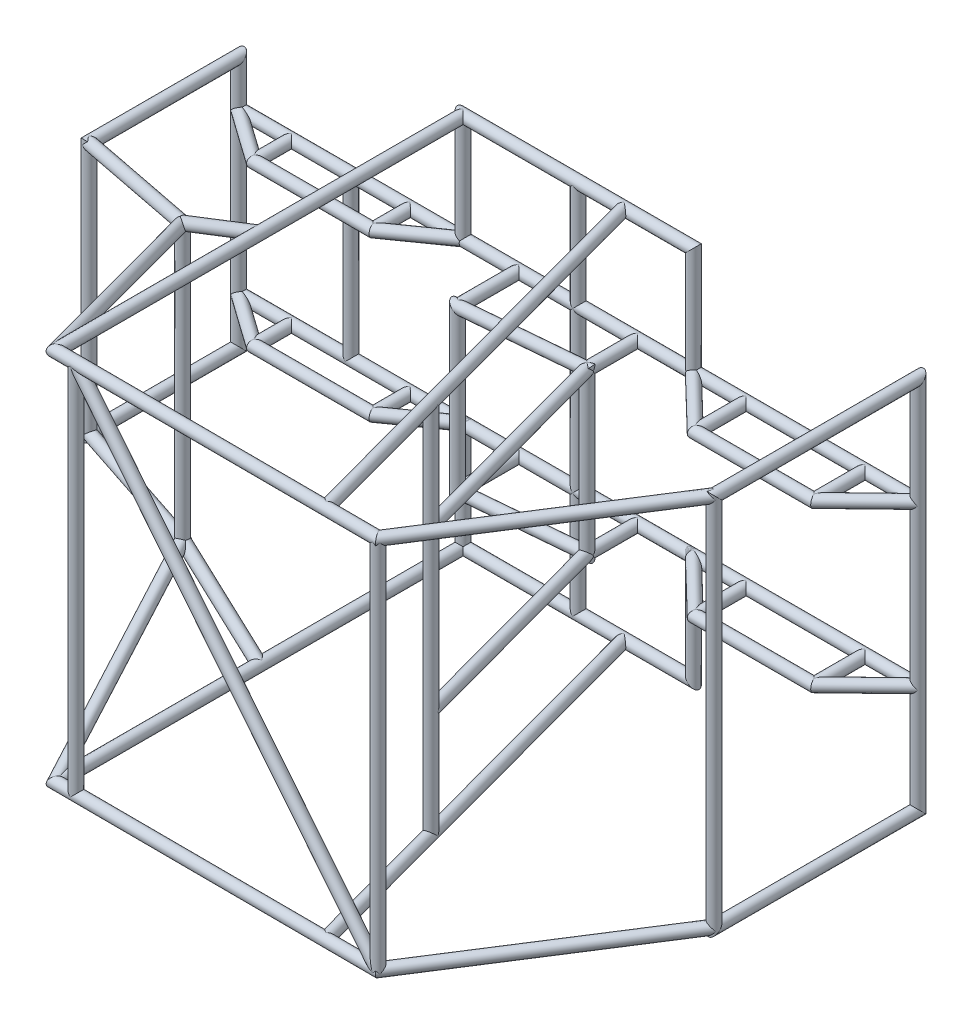
from build123d import *

# Parameters (mm, degrees)
SKETCH1171_R                     = 16.7005
SKETCH1171_R_2                   = 13.3223
PIPE_1_0_SCH_40_15_DEPTH         = 685.618073598
SKETCH1171_ON_SEGMENT_2_R        = 16.7005
SKETCH1171_ON_SEGMENT_2_R_2      = 13.3223
PIPE_1_0_SCH_40_15_2_DEPTH       = 364.236147197
SKETCH1171_ON_SEGMENT_3_R        = 16.7005
SKETCH1171_ON_SEGMENT_3_R_2      = 13.3223
PIPE_1_0_SCH_40_15_3_DEPTH       = 727.236147197
SKETCH1171_ON_SEGMENT_4_R        = 16.7005
SKETCH1171_ON_SEGMENT_4_R_2      = 13.3223
PIPE_1_0_SCH_40_15_4_DEPTH       = 364.236147197
SKETCH1171_ON_SEGMENT_5_R        = 16.7005
SKETCH1171_ON_SEGMENT_5_R_2      = 13.3223
PIPE_1_0_SCH_40_15_5_DEPTH       = 685.618073598
SKETCH118_R                      = 16.7005
SKETCH118_R_2                    = 13.3223
PIPE_1_0_SCH_40_16_DEPTH         = 685.618073598
SKETCH118_ON_SEGMENT_2_R         = 16.7005
SKETCH118_ON_SEGMENT_2_R_2       = 13.3223
PIPE_1_0_SCH_40_16_2_DEPTH       = 364.236147197
SKETCH118_ON_SEGMENT_3_R         = 16.7005
SKETCH118_ON_SEGMENT_3_R_2       = 13.3223
PIPE_1_0_SCH_40_16_3_DEPTH       = 727.236147197
SKETCH118_ON_SEGMENT_4_R         = 16.7005
SKETCH118_ON_SEGMENT_4_R_2       = 13.3223
PIPE_1_0_SCH_40_16_4_DEPTH       = 364.236147197
SKETCH118_ON_SEGMENT_5_R         = 16.7005
SKETCH118_ON_SEGMENT_5_R_2       = 13.3223
PIPE_1_0_SCH_40_16_5_DEPTH       = 685.618073598
PIPE_1_0_SCH_40_18_DEPTH         = 464.618073598
PIPE_1_0_SCH_40_18_DEPTH_BACK    = 24.618073598
SKETCH120_R                      = 16.7005
SKETCH120_R_2                    = 13.3223
SKETCH120_ON_SEGMENT_2_R         = 16.7005
SKETCH120_ON_SEGMENT_2_R_2       = 13.3223
PIPE_1_0_SCH_40_18_2_DEPTH       = 789.236147197
SKETCH120_ON_SEGMENT_3_R         = 16.7005
SKETCH120_ON_SEGMENT_3_R_2       = 13.3223
PIPE_1_0_SCH_40_18_3_DEPTH       = 489.236147197
SKETCH120_ON_SEGMENT_4_R         = 16.7005
SKETCH120_ON_SEGMENT_4_R_2       = 13.3223
PIPE_1_0_SCH_40_18_4_DEPTH       = 789.236147197
PIPE_1_0_SCH_40_19_DEPTH         = 624.618073598
PIPE_1_0_SCH_40_19_DEPTH_BACK    = 24.618073598
SKETCH121_R                      = 16.7005
SKETCH121_R_2                    = 13.3223
SKETCH121_ON_SEGMENT_2_R         = 16.7005
SKETCH121_ON_SEGMENT_2_R_2       = 13.3223
PIPE_1_0_SCH_40_19_2_DEPTH       = 1149.236147197
SKETCH121_ON_SEGMENT_3_R         = 16.7005
SKETCH121_ON_SEGMENT_3_R_2       = 13.3223
PIPE_1_0_SCH_40_19_3_DEPTH       = 649.236147197
SKETCH121_ON_SEGMENT_4_R         = 16.7005
SKETCH121_ON_SEGMENT_4_R_2       = 13.3223
PIPE_1_0_SCH_40_19_4_DEPTH       = 1149.236147197
SKETCH134_R                      = 16.7005
SKETCH134_R_2                    = 13.3223
PIPE_1_0_SCH_40_30_DEPTH         = 1100
SKETCH1186_R                     = 16.7005
SKETCH1186_R_2                   = 13.3223
PIPE_1_0_SCH_40_107_DEPTH        = 1200
SKETCH1186_ON_SEGMENT_2_R        = 16.7005
SKETCH1186_ON_SEGMENT_2_R_2      = 13.3223
PIPE_1_0_SCH_40_107_2_DEPTH      = 1200
SKETCH1187_R                     = 16.7005
SKETCH1187_R_2                   = 13.3223
PIPE_1_0_SCH_40_108_DEPTH        = 678
SKETCH1187_ON_SEGMENT_2_R        = 16.7005
SKETCH1187_ON_SEGMENT_2_R_2      = 13.3223
PIPE_1_0_SCH_40_108_2_DEPTH      = 678
PIPE_1_0_SCH_40_109_DEPTH        = 375.955016739
PIPE_1_0_SCH_40_109_DEPTH_BACK   = 24.618073598
SKETCH1188_R                     = 16.7005
SKETCH1188_R_2                   = 13.3223
SKETCH1188_ON_SEGMENT_2_R        = 16.7005
SKETCH1188_ON_SEGMENT_2_R_2      = 13.3223
PIPE_1_0_SCH_40_109_2_DEPTH      = 519.236147197
SKETCH1188_ON_SEGMENT_3_R        = 16.7005
SKETCH1188_ON_SEGMENT_3_R_2      = 13.3223
PIPE_1_0_SCH_40_109_3_DEPTH      = 400.573090337
SKETCH1188_ON_SEGMENT_4_R        = 16.7005
SKETCH1188_ON_SEGMENT_4_R_2      = 13.3223
PIPE_1_0_SCH_40_109_4_DEPTH      = 519.236147197
SKETCH1198_R                     = 16.7005
SKETCH1198_R_2                   = 13.3223
PIPE_1_0_SCH_40_168_DEPTH        = 180
SKETCH1198_ON_SEGMENT_2_R        = 16.7005
SKETCH1198_ON_SEGMENT_2_R_2      = 13.3223
PIPE_1_0_SCH_40_168_2_DEPTH      = 180
SKETCH1198_ON_SEGMENT_3_R        = 16.7005
SKETCH1198_ON_SEGMENT_3_R_2      = 13.3223
PIPE_1_0_SCH_40_168_3_DEPTH      = 149.378967766
SKETCH1198_ON_SEGMENT_4_R        = 16.7005
SKETCH1198_ON_SEGMENT_4_R_2      = 13.3223
PIPE_1_0_SCH_40_168_4_DEPTH      = 149.378967766
SKETCH1202_R                     = 16.7005
SKETCH1202_R_2                   = 13.3223
PIPE_1_0_SCH_40_207_DEPTH        = 1100
SKETCH1202_ON_SEGMENT_2_R        = 16.7005
SKETCH1202_ON_SEGMENT_2_R_2      = 13.3223
PIPE_1_0_SCH_40_207_2_DEPTH      = 1100
SKETCH1203_R                     = 16.7005
SKETCH1203_R_2                   = 13.3223
PIPE_1_0_SCH_40_208_DEPTH        = 1417.616753185
SKETCH1204_R                     = 16.7005
SKETCH1204_R_2                   = 13.3223
PIPE_1_0_SCH_40_209_DEPTH        = 1242.33611986
SKETCH1204_ON_SEGMENT_2_R        = 16.7005
SKETCH1204_ON_SEGMENT_2_R_2      = 13.3223
PIPE_1_0_SCH_40_209_2_DEPTH      = 1242.33611986
SKETCH1205_R                     = 16.7005
SKETCH1205_R_2                   = 13.3223
PIPE_1_0_SCH_40_210_DEPTH        = 1100
SKETCH1207_R                     = 16.7005
SKETCH1207_R_2                   = 13.3223
PIPE_1_0_SCH_40_234_DEPTH        = 650
SKETCH1208_R                     = 16.7005
SKETCH1208_R_2                   = 13.3223
PIPE_1_0_SCH_40_235_DEPTH        = 650
SKETCH1212_R                     = 16.7005
SKETCH1212_R_2                   = 13.3223
PIPE_1_0_SCH_40_351_DEPTH        = 404.242184059
SKETCH1212_ON_SEGMENT_2_R        = 16.7005
SKETCH1212_ON_SEGMENT_2_R_2      = 13.3223
PIPE_1_0_SCH_40_351_2_DEPTH      = 760.932128406
SKETCH1212_ON_SEGMENT_3_R        = 16.7005
SKETCH1212_ON_SEGMENT_3_R_2      = 13.3223
PIPE_1_0_SCH_40_351_3_DEPTH      = 980.503844292
SKETCH1212_ON_SEGMENT_4_R        = 16.7005
SKETCH1212_ON_SEGMENT_4_R_2      = 13.3223
PIPE_1_0_SCH_40_351_4_DEPTH      = 728.915360528
SKETCH1213_R                     = 16.7005
SKETCH1213_R_2                   = 13.3223
PIPE_1_0_SCH_40_352_DEPTH        = 404.244649491
SKETCH1213_ON_SEGMENT_2_R        = 16.7005
SKETCH1213_ON_SEGMENT_2_R_2      = 13.3223
PIPE_1_0_SCH_40_352_2_DEPTH      = 760.95722895
SKETCH1213_ON_SEGMENT_3_R        = 16.7005
SKETCH1213_ON_SEGMENT_3_R_2      = 13.3223
PIPE_1_0_SCH_40_352_3_DEPTH      = 980.530420984
SKETCH1213_ON_SEGMENT_4_R        = 16.7005
SKETCH1213_ON_SEGMENT_4_R_2      = 13.3223
PIPE_1_0_SCH_40_352_4_DEPTH      = 728.915360528
SKETCH1214_R                     = 16.7005
SKETCH1214_R_2                   = 13.3223
PIPE_1_0_SCH_40_353_DEPTH        = 808.307653414
SKETCH1215_R                     = 16.7005
SKETCH1215_R_2                   = 13.3223
PIPE_1_0_SCH_40_368_DEPTH        = 324.612827971
SKETCH1216_R                     = 16.7005
SKETCH1216_R_2                   = 13.3223
PIPE_1_0_SCH_40_369_DEPTH        = 324.610576097
SKETCH1225_R                     = 16.7005
SKETCH1225_R_2                   = 13.3223
PIPE_1_0_SCH_40_501_DEPTH        = 470
SKETCH1231_ON_SEGMENT_1_R        = 16.7005
SKETCH1231_ON_SEGMENT_1_R_2      = 13.3223
PIPE_1_0_SCH_40_533_DEPTH        = 198.982957257
SKETCH1231_ON_SEGMENT_2_R        = 16.7005
SKETCH1231_ON_SEGMENT_2_R_2      = 13.3223
PIPE_1_0_SCH_40_533_2_DEPTH      = 367.018411569
PIPE_1_0_SCH_40_533_3_DEPTH      = 190.473751472
PIPE_1_0_SCH_40_533_3_DEPTH_BACK = 8.509205784
SKETCH1231_R                     = 16.7005
SKETCH1231_R_2                   = 13.3223
SKETCH1232_ON_SEGMENT_1_R        = 16.7005
SKETCH1232_ON_SEGMENT_1_R_2      = 13.3223
PIPE_1_0_SCH_40_534_DEPTH        = 198.982957257
SKETCH1232_ON_SEGMENT_2_R        = 16.7005
SKETCH1232_ON_SEGMENT_2_R_2      = 13.3223
PIPE_1_0_SCH_40_534_2_DEPTH      = 367.018411569
PIPE_1_0_SCH_40_534_3_DEPTH      = 190.473751472
PIPE_1_0_SCH_40_534_3_DEPTH_BACK = 8.509205784
SKETCH1232_R                     = 16.7005
SKETCH1232_R_2                   = 13.3223
SKETCH1233_ON_SEGMENT_1_R        = 16.7005
SKETCH1233_ON_SEGMENT_1_R_2      = 13.3223
PIPE_1_0_SCH_40_535_DEPTH        = 226.590920724
SKETCH1233_ON_SEGMENT_2_R        = 16.7005
SKETCH1233_ON_SEGMENT_2_R_2      = 13.3223
PIPE_1_0_SCH_40_535_2_DEPTH      = 371.069587514
PIPE_1_0_SCH_40_535_3_DEPTH      = 216.056126967
PIPE_1_0_SCH_40_535_3_DEPTH_BACK = 10.534793757
SKETCH1233_R                     = 16.7005
SKETCH1233_R_2                   = 13.3223
SKETCH1234_ON_SEGMENT_1_R        = 16.7005
SKETCH1234_ON_SEGMENT_1_R_2      = 13.3223
PIPE_1_0_SCH_40_536_DEPTH        = 226.590920724
SKETCH1234_ON_SEGMENT_2_R        = 16.7005
SKETCH1234_ON_SEGMENT_2_R_2      = 13.3223
PIPE_1_0_SCH_40_536_2_DEPTH      = 371.069587514
PIPE_1_0_SCH_40_536_3_DEPTH      = 216.056126967
PIPE_1_0_SCH_40_536_3_DEPTH_BACK = 10.534793757
SKETCH1234_R                     = 16.7005
SKETCH1234_R_2                   = 13.3223
SKETCH1235_R                     = 16.7005
SKETCH1235_R_2                   = 13.3223
PIPE_1_0_SCH_40_537_DEPTH        = 110
SKETCH1235_ON_SEGMENT_2_R        = 16.7005
SKETCH1235_ON_SEGMENT_2_R_2      = 13.3223
PIPE_1_0_SCH_40_537_2_DEPTH      = 110
SKETCH1235_ON_SEGMENT_3_R        = 16.7005
SKETCH1235_ON_SEGMENT_3_R_2      = 13.3223
PIPE_1_0_SCH_40_537_3_DEPTH      = 110
SKETCH1235_ON_SEGMENT_4_R        = 16.7005
SKETCH1235_ON_SEGMENT_4_R_2      = 13.3223
PIPE_1_0_SCH_40_537_4_DEPTH      = 110
SKETCH1235_ON_SEGMENT_5_R        = 16.7005
SKETCH1235_ON_SEGMENT_5_R_2      = 13.3223
PIPE_1_0_SCH_40_537_5_DEPTH      = 150
SKETCH1235_ON_SEGMENT_6_R        = 16.7005
SKETCH1235_ON_SEGMENT_6_R_2      = 13.3223
PIPE_1_0_SCH_40_537_6_DEPTH      = 150
SKETCH1235_ON_SEGMENT_7_R        = 16.7005
SKETCH1235_ON_SEGMENT_7_R_2      = 13.3223
PIPE_1_0_SCH_40_537_7_DEPTH      = 150
SKETCH1235_ON_SEGMENT_8_R        = 16.7005
SKETCH1235_ON_SEGMENT_8_R_2      = 13.3223
PIPE_1_0_SCH_40_537_8_DEPTH      = 150


with BuildPart() as part:
    # Sketch1171 → Pipe 1.0 SCH 40(15) (new body)
    with BuildSketch(Plane(origin=(-979.966611018, -151.135225376, 0), x_dir=(0, 1, 0), z_dir=(1, 0, 0))):
        Circle(SKETCH1171_R)
        Circle(SKETCH1171_R_2, mode=Mode.SUBTRACT)
    extrude(amount=PIPE_1_0_SCH_40_15_DEPTH)

    # Pipe 1.0 SCH 40(15) mitre 1
    split(bisect_by=Plane(origin=(-318.966611018, -151.135225376, 0), x_dir=(-0.707106781, -0.707106781, 0), z_dir=(-0.707106781, 0.707106781, 0)), keep=Keep.TOP)


with BuildPart() as body_2:
    # Sketch1171 on segment 2 (carried to segment 2) → Pipe 1.0 SCH 40_15 2 (new body)
    with BuildSketch(Plane(origin=(-318.966611018, -126.517151777, 0), x_dir=(1, 0, 0), z_dir=(0, -1, 0))):
        Circle(SKETCH1171_ON_SEGMENT_2_R)
        Circle(SKETCH1171_ON_SEGMENT_2_R_2, mode=Mode.SUBTRACT)
    extrude(amount=PIPE_1_0_SCH_40_15_2_DEPTH)

    # Pipe 1.0 SCH 40_15 2 mitre 1
    split(bisect_by=Plane(origin=(-318.966611018, -151.135225376, 0), x_dir=(0.707106781, 0.707106781, 0), z_dir=(0.707106781, -0.707106781, 0)), keep=Keep.TOP)

    # Pipe 1.0 SCH 40_15 2 mitre 2
    split(bisect_by=Plane(origin=(-318.966611018, -466.135225376, 0), x_dir=(-0.707106781, -0.707106781, 0), z_dir=(-0.707106781, 0.707106781, 0)), keep=Keep.TOP)


with BuildPart() as body_3:
    # Sketch1171 on segment 3 (carried to segment 3) → Pipe 1.0 SCH 40_15 3 (new body)
    with BuildSketch(Plane(origin=(-343.584684617, -466.135225376, 0), x_dir=(0, 1, 0), z_dir=(1, 0, 0))):
        Circle(SKETCH1171_ON_SEGMENT_3_R)
        Circle(SKETCH1171_ON_SEGMENT_3_R_2, mode=Mode.SUBTRACT)
    extrude(amount=PIPE_1_0_SCH_40_15_3_DEPTH)

    # Pipe 1.0 SCH 40_15 3 mitre 1
    split(bisect_by=Plane(origin=(-318.966611018, -466.135225376, 0), x_dir=(0.707106781, 0.707106781, 0), z_dir=(0.707106781, -0.707106781, 0)), keep=Keep.TOP)

    # Pipe 1.0 SCH 40_15 3 mitre 2
    split(bisect_by=Plane(origin=(359.033388982, -466.135225376, 0), x_dir=(0.707106781, -0.707106781, 0), z_dir=(-0.707106781, -0.707106781, 0)), keep=Keep.TOP)


with BuildPart() as body_4:
    # Sketch1171 on segment 4 (carried to segment 4) → Pipe 1.0 SCH 40_15 4 (new body)
    with BuildSketch(Plane(origin=(359.033388982, -490.753298974, 0), x_dir=(-1, 0, 0), z_dir=(0, 1, 0))):
        Circle(SKETCH1171_ON_SEGMENT_4_R)
        Circle(SKETCH1171_ON_SEGMENT_4_R_2, mode=Mode.SUBTRACT)
    extrude(amount=PIPE_1_0_SCH_40_15_4_DEPTH)

    # Pipe 1.0 SCH 40_15 4 mitre 1
    split(bisect_by=Plane(origin=(359.033388982, -466.135225376, 0), x_dir=(-0.707106781, 0.707106781, 0), z_dir=(0.707106781, 0.707106781, 0)), keep=Keep.TOP)

    # Pipe 1.0 SCH 40_15 4 mitre 2
    split(bisect_by=Plane(origin=(359.033388982, -151.135225376, 0), x_dir=(0.707106781, -0.707106781, 0), z_dir=(-0.707106781, -0.707106781, 0)), keep=Keep.TOP)


with BuildPart() as body_5:
    # Sketch1171 on segment 5 (carried to segment 5) → Pipe 1.0 SCH 40_15 5 (new body)
    with BuildSketch(Plane(origin=(334.415315383, -151.135225376, 0), x_dir=(0, 1, 0), z_dir=(1, 0, 0))):
        Circle(SKETCH1171_ON_SEGMENT_5_R)
        Circle(SKETCH1171_ON_SEGMENT_5_R_2, mode=Mode.SUBTRACT)
    extrude(amount=PIPE_1_0_SCH_40_15_5_DEPTH)

    # Pipe 1.0 SCH 40_15 5 mitre 1
    split(bisect_by=Plane(origin=(359.033388982, -151.135225376, 0), x_dir=(-0.707106781, 0.707106781, 0), z_dir=(0.707106781, 0.707106781, 0)), keep=Keep.TOP)


with BuildPart() as body_6:
    # Sketch118 → Pipe 1.0 SCH 40(16) (new body)
    with BuildSketch(Plane(origin=(-979.966611018, 318.864774624, 0), x_dir=(0, 1, 0), z_dir=(1, 0, 0))):
        Circle(SKETCH118_R)
        Circle(SKETCH118_R_2, mode=Mode.SUBTRACT)
    extrude(amount=PIPE_1_0_SCH_40_16_DEPTH)

    # Pipe 1.0 SCH 40(16) mitre 1
    split(bisect_by=Plane(origin=(-318.966611018, 318.864774624, 0), x_dir=(0.707106781, -0.707106781, 0), z_dir=(-0.707106781, -0.707106781, 0)), keep=Keep.TOP)


with BuildPart() as body_7:
    # Sketch118 on segment 2 (carried to segment 2) → Pipe 1.0 SCH 40_16 2 (new body)
    with BuildSketch(Plane(origin=(-318.966611018, 294.246701026, 0), x_dir=(-1, 0, 0), z_dir=(0, 1, 0))):
        Circle(SKETCH118_ON_SEGMENT_2_R)
        Circle(SKETCH118_ON_SEGMENT_2_R_2, mode=Mode.SUBTRACT)
    extrude(amount=PIPE_1_0_SCH_40_16_2_DEPTH)

    # Pipe 1.0 SCH 40_16 2 mitre 1
    split(bisect_by=Plane(origin=(-318.966611018, 318.864774624, 0), x_dir=(-0.707106781, 0.707106781, 0), z_dir=(0.707106781, 0.707106781, 0)), keep=Keep.TOP)

    # Pipe 1.0 SCH 40_16 2 mitre 2
    split(bisect_by=Plane(origin=(-318.966611018, 633.864774624, 0), x_dir=(0.707106781, -0.707106781, 0), z_dir=(-0.707106781, -0.707106781, 0)), keep=Keep.TOP)


with BuildPart() as body_8:
    # Sketch118 on segment 3 (carried to segment 3) → Pipe 1.0 SCH 40_16 3 (new body)
    with BuildSketch(Plane(origin=(-343.584684617, 633.864774624, 0), x_dir=(0, 1, 0), z_dir=(1, 0, 0))):
        Circle(SKETCH118_ON_SEGMENT_3_R)
        Circle(SKETCH118_ON_SEGMENT_3_R_2, mode=Mode.SUBTRACT)
    extrude(amount=PIPE_1_0_SCH_40_16_3_DEPTH)

    # Pipe 1.0 SCH 40_16 3 mitre 1
    split(bisect_by=Plane(origin=(-318.966611018, 633.864774624, 0), x_dir=(-0.707106781, 0.707106781, 0), z_dir=(0.707106781, 0.707106781, 0)), keep=Keep.TOP)

    # Pipe 1.0 SCH 40_16 3 mitre 2
    split(bisect_by=Plane(origin=(359.033388982, 633.864774624, 0), x_dir=(-0.707106781, -0.707106781, 0), z_dir=(-0.707106781, 0.707106781, 0)), keep=Keep.TOP)


with BuildPart() as body_9:
    # Sketch118 on segment 4 (carried to segment 4) → Pipe 1.0 SCH 40_16 4 (new body)
    with BuildSketch(Plane(origin=(359.033388982, 658.482848223, 0), x_dir=(1, 0, 0), z_dir=(0, -1, 0))):
        Circle(SKETCH118_ON_SEGMENT_4_R)
        Circle(SKETCH118_ON_SEGMENT_4_R_2, mode=Mode.SUBTRACT)
    extrude(amount=PIPE_1_0_SCH_40_16_4_DEPTH)

    # Pipe 1.0 SCH 40_16 4 mitre 1
    split(bisect_by=Plane(origin=(359.033388982, 633.864774624, 0), x_dir=(0.707106781, 0.707106781, 0), z_dir=(0.707106781, -0.707106781, 0)), keep=Keep.TOP)

    # Pipe 1.0 SCH 40_16 4 mitre 2
    split(bisect_by=Plane(origin=(359.033388982, 318.864774624, 0), x_dir=(-0.707106781, -0.707106781, 0), z_dir=(-0.707106781, 0.707106781, 0)), keep=Keep.TOP)


with BuildPart() as body_10:
    # Sketch118 on segment 5 (carried to segment 5) → Pipe 1.0 SCH 40_16 5 (new body)
    with BuildSketch(Plane(origin=(334.415315383, 318.864774624, 0), x_dir=(0, 1, 0), z_dir=(1, 0, 0))):
        Circle(SKETCH118_ON_SEGMENT_5_R)
        Circle(SKETCH118_ON_SEGMENT_5_R_2, mode=Mode.SUBTRACT)
    extrude(amount=PIPE_1_0_SCH_40_16_5_DEPTH)

    # Pipe 1.0 SCH 40_16 5 mitre 1
    split(bisect_by=Plane(origin=(359.033388982, 318.864774624, 0), x_dir=(0.707106781, 0.707106781, 0), z_dir=(0.707106781, -0.707106781, 0)), keep=Keep.TOP)


with BuildPart() as body_11:
    # Sketch120 → Pipe 1.0 SCH 40(18) (new, two sides: drawn at the far end of the back side and taken through both)
    with BuildSketch(Plane(origin=(-979.966611018, -286.135225376, 0), x_dir=(1, 0, 0), z_dir=(0, 0, 1)).offset(-PIPE_1_0_SCH_40_18_DEPTH_BACK)):
        Circle(SKETCH120_R)
        Circle(SKETCH120_R_2, mode=Mode.SUBTRACT)
    extrude(amount=PIPE_1_0_SCH_40_18_DEPTH + PIPE_1_0_SCH_40_18_DEPTH_BACK)

    # Pipe 1.0 SCH 40(18) mitre 1
    split(bisect_by=Plane(origin=(-979.966611018, -286.135225376, 0), x_dir=(1, 0, 0), z_dir=(0, -0.707106781, 0.707106781)), keep=Keep.TOP)

    # Pipe 1.0 SCH 40(18) mitre 2
    split(bisect_by=Plane(origin=(-979.966611018, -286.135225376, 440), x_dir=(1, 0, 0), z_dir=(0, -0.707106781, -0.707106781)), keep=Keep.TOP)


with BuildPart() as body_12:
    # Sketch120 on segment 2 (carried to segment 2) → Pipe 1.0 SCH 40_18 2 (new body)
    with BuildSketch(Plane(origin=(-979.966611018, -310.753298974, 440), x_dir=(1, 0, 0), z_dir=(0, 1, 0))):
        Circle(SKETCH120_ON_SEGMENT_2_R)
        Circle(SKETCH120_ON_SEGMENT_2_R_2, mode=Mode.SUBTRACT)
    extrude(amount=PIPE_1_0_SCH_40_18_2_DEPTH)

    # Pipe 1.0 SCH 40_18 2 mitre 1
    split(bisect_by=Plane(origin=(-979.966611018, 453.864774624, 440), x_dir=(1, 0, 0), z_dir=(0, -0.707106781, 0.707106781)), keep=Keep.TOP)

    # Pipe 1.0 SCH 40_18 2 mitre 2
    split(bisect_by=Plane(origin=(-979.966611018, -286.135225376, 440), x_dir=(-1, 0, 0), z_dir=(0, 0.707106781, 0.707106781)), keep=Keep.TOP)


with BuildPart() as body_13:
    # Sketch120 on segment 3 (carried to segment 3) → Pipe 1.0 SCH 40_18 3 (new body)
    with BuildSketch(Plane(origin=(-979.966611018, 453.864774624, 464.618073598), x_dir=(1, 0, 0), z_dir=(0, 0, -1))):
        Circle(SKETCH120_ON_SEGMENT_3_R)
        Circle(SKETCH120_ON_SEGMENT_3_R_2, mode=Mode.SUBTRACT)
    extrude(amount=PIPE_1_0_SCH_40_18_3_DEPTH)

    # Pipe 1.0 SCH 40_18 3 mitre 1
    split(bisect_by=Plane(origin=(-979.966611018, 453.864774624, 0), x_dir=(-1, 0, 0), z_dir=(0, 0.707106781, 0.707106781)), keep=Keep.TOP)

    # Pipe 1.0 SCH 40_18 3 mitre 2
    split(bisect_by=Plane(origin=(-979.966611018, 453.864774624, 440), x_dir=(-1, 0, 0), z_dir=(0, 0.707106781, -0.707106781)), keep=Keep.TOP)


with BuildPart() as body_14:
    # Sketch120 on segment 4 (carried to segment 4) → Pipe 1.0 SCH 40_18 4 (new body)
    with BuildSketch(Plane(origin=(-979.966611018, 478.482848223, 0), x_dir=(1, 0, 0), z_dir=(0, -1, 0))):
        Circle(SKETCH120_ON_SEGMENT_4_R)
        Circle(SKETCH120_ON_SEGMENT_4_R_2, mode=Mode.SUBTRACT)
    extrude(amount=PIPE_1_0_SCH_40_18_4_DEPTH)

    # Pipe 1.0 SCH 40_18 4 mitre 1
    split(bisect_by=Plane(origin=(-979.966611018, -286.135225376, 0), x_dir=(-1, 0, 0), z_dir=(0, 0.707106781, -0.707106781)), keep=Keep.TOP)

    # Pipe 1.0 SCH 40_18 4 mitre 2
    split(bisect_by=Plane(origin=(-979.966611018, 453.864774624, 0), x_dir=(1, 0, 0), z_dir=(0, -0.707106781, -0.707106781)), keep=Keep.TOP)


with BuildPart() as body_15:
    # Sketch121 → Pipe 1.0 SCH 40(19) (new, two sides: drawn at the far end of the back side and taken through both)
    with BuildSketch(Plane(origin=(1020.033388982, -466.135225376, 0), x_dir=(1, 0, 0), z_dir=(0, 0, 1)).offset(-PIPE_1_0_SCH_40_19_DEPTH_BACK)):
        Circle(SKETCH121_R)
        Circle(SKETCH121_R_2, mode=Mode.SUBTRACT)
    extrude(amount=PIPE_1_0_SCH_40_19_DEPTH + PIPE_1_0_SCH_40_19_DEPTH_BACK)

    # Pipe 1.0 SCH 40(19) mitre 1
    split(bisect_by=Plane(origin=(1020.033388982, -466.135225376, 0), x_dir=(1, 0, 0), z_dir=(0, -0.707106781, 0.707106781)), keep=Keep.TOP)

    # Pipe 1.0 SCH 40(19) mitre 2
    split(bisect_by=Plane(origin=(1020.033388982, -466.135225376, 600), x_dir=(1, 0, 0), z_dir=(0, -0.707106781, -0.707106781)), keep=Keep.TOP)


with BuildPart() as body_16:
    # Sketch121 on segment 2 (carried to segment 2) → Pipe 1.0 SCH 40_19 2 (new body)
    with BuildSketch(Plane(origin=(1020.033388982, -490.753298974, 600), x_dir=(1, 0, 0), z_dir=(0, 1, 0))):
        Circle(SKETCH121_ON_SEGMENT_2_R)
        Circle(SKETCH121_ON_SEGMENT_2_R_2, mode=Mode.SUBTRACT)
    extrude(amount=PIPE_1_0_SCH_40_19_2_DEPTH)

    # Pipe 1.0 SCH 40_19 2 mitre 1
    split(bisect_by=Plane(origin=(1020.033388982, -466.135225376, 600), x_dir=(-1, 0, 0), z_dir=(0, 0.707106781, 0.707106781)), keep=Keep.TOP)

    # Pipe 1.0 SCH 40_19 2 mitre 2
    split(bisect_by=Plane(origin=(1020.033388982, 633.864774624, 600), x_dir=(1, 0, 0), z_dir=(0, -0.707106781, 0.707106781)), keep=Keep.TOP)


with BuildPart() as body_17:
    # Sketch121 on segment 3 (carried to segment 3) → Pipe 1.0 SCH 40_19 3 (new body)
    with BuildSketch(Plane(origin=(1020.033388982, 633.864774624, 624.618073598), x_dir=(1, 0, 0), z_dir=(0, 0, -1))):
        Circle(SKETCH121_ON_SEGMENT_3_R)
        Circle(SKETCH121_ON_SEGMENT_3_R_2, mode=Mode.SUBTRACT)
    extrude(amount=PIPE_1_0_SCH_40_19_3_DEPTH)

    # Pipe 1.0 SCH 40_19 3 mitre 1
    split(bisect_by=Plane(origin=(1020.033388982, 633.864774624, 0), x_dir=(-1, 0, 0), z_dir=(0, 0.707106781, 0.707106781)), keep=Keep.TOP)

    # Pipe 1.0 SCH 40_19 3 mitre 2
    split(bisect_by=Plane(origin=(1020.033388982, 633.864774624, 600), x_dir=(-1, 0, 0), z_dir=(0, 0.707106781, -0.707106781)), keep=Keep.TOP)


with BuildPart() as body_18:
    # Sketch121 on segment 4 (carried to segment 4) → Pipe 1.0 SCH 40_19 4 (new body)
    with BuildSketch(Plane(origin=(1020.033388982, 658.482848223, 0), x_dir=(1, 0, 0), z_dir=(0, -1, 0))):
        Circle(SKETCH121_ON_SEGMENT_4_R)
        Circle(SKETCH121_ON_SEGMENT_4_R_2, mode=Mode.SUBTRACT)
    extrude(amount=PIPE_1_0_SCH_40_19_4_DEPTH)

    # Pipe 1.0 SCH 40_19 4 mitre 1
    split(bisect_by=Plane(origin=(1020.033388982, 633.864774624, 0), x_dir=(1, 0, 0), z_dir=(0, -0.707106781, -0.707106781)), keep=Keep.TOP)

    # Pipe 1.0 SCH 40_19 4 mitre 2
    split(bisect_by=Plane(origin=(1020.033388982, -466.135225376, 0), x_dir=(-1, 0, 0), z_dir=(0, 0.707106781, -0.707106781)), keep=Keep.TOP)


with BuildPart() as body_19:
    # Sketch134 → Pipe 1.0 SCH 40(30) (new body)
    with BuildSketch(Plane(origin=(20.033388982, -466.135225376, 0), x_dir=(1, 0, 0), z_dir=(0, 1, 0))):
        Circle(SKETCH134_R)
        Circle(SKETCH134_R_2, mode=Mode.SUBTRACT)
    extrude(amount=PIPE_1_0_SCH_40_30_DEPTH)


with BuildPart() as body_20:
    # Sketch1186 → Pipe 1.0 SCH 40(107) (new body)
    with BuildSketch(Plane(origin=(-318.966611018, 633.864774624, 0), x_dir=(1, 0, 0), z_dir=(0, 0, 1))):
        Circle(SKETCH1186_R)
        Circle(SKETCH1186_R_2, mode=Mode.SUBTRACT)
    extrude(amount=PIPE_1_0_SCH_40_107_DEPTH)


with BuildPart() as body_21:
    # Sketch1186 on segment 2 (carried to segment 2) → Pipe 1.0 SCH 40_107 2 (new body)
    with BuildSketch(Plane(origin=(-318.966611018, -466.135225376, 0), x_dir=(1, 0, 0), z_dir=(0, 0, 1))):
        Circle(SKETCH1186_ON_SEGMENT_2_R)
        Circle(SKETCH1186_ON_SEGMENT_2_R_2, mode=Mode.SUBTRACT)
    extrude(amount=PIPE_1_0_SCH_40_107_2_DEPTH)


with BuildPart() as body_22:
    # Sketch1187 → Pipe 1.0 SCH 40(108) (new body)
    with BuildSketch(Plane(origin=(-318.966611018, -151.135225376, 0), x_dir=(0, 0, -1), z_dir=(1, 0, 0))):
        Circle(SKETCH1187_R)
        Circle(SKETCH1187_R_2, mode=Mode.SUBTRACT)
    extrude(amount=PIPE_1_0_SCH_40_108_DEPTH)


with BuildPart() as body_23:
    # Sketch1187 on segment 2 (carried to segment 2) → Pipe 1.0 SCH 40_108 2 (new body)
    with BuildSketch(Plane(origin=(-318.966611018, 318.864774624, 0), x_dir=(0, 0, -1), z_dir=(1, 0, 0))):
        Circle(SKETCH1187_ON_SEGMENT_2_R)
        Circle(SKETCH1187_ON_SEGMENT_2_R_2, mode=Mode.SUBTRACT)
    extrude(amount=PIPE_1_0_SCH_40_108_2_DEPTH)


with BuildPart() as body_24:
    # Sketch1188 → Pipe 1.0 SCH 40(109) (new, two sides: drawn at the far end of the back side and taken through both)
    with BuildSketch(Plane(origin=(-154.966611018, -151.135225376, 180), x_dir=(-0.08715574274766213, 0, -0.9961946980917453), z_dir=(0.9961946980917453, 0, -0.08715574274766213)).offset(-PIPE_1_0_SCH_40_109_DEPTH_BACK)):
        Circle(SKETCH1188_R)
        Circle(SKETCH1188_R_2, mode=Mode.SUBTRACT)
    extrude(amount=PIPE_1_0_SCH_40_109_DEPTH + PIPE_1_0_SCH_40_109_DEPTH_BACK)

    # Pipe 1.0 SCH 40(109) mitre 1
    split(bisect_by=Plane(origin=(-154.966611018, -151.135225376, 180), x_dir=(0.708453436, 0.705757557, 0), z_dir=(0.704416026, -0.707106781, -0.061628417)), keep=Keep.TOP)

    # Pipe 1.0 SCH 40(109) mitre 2
    split(bisect_by=Plane(origin=(195.033388982, -151.135225376, 149.378967766), x_dir=(0.708453436, -0.705757557, 0), z_dir=(-0.704416026, -0.707106781, 0.061628417)), keep=Keep.TOP)


with BuildPart() as body_25:
    # Sketch1188 on segment 2 (carried to segment 2) → Pipe 1.0 SCH 40_109 2 (new body)
    with BuildSketch(Plane(origin=(195.033388982, -175.753298974, 149.378967766), x_dir=(-0.087155743, 0, -0.996194698), z_dir=(0, 1, 0))):
        Circle(SKETCH1188_ON_SEGMENT_2_R)
        Circle(SKETCH1188_ON_SEGMENT_2_R_2, mode=Mode.SUBTRACT)
    extrude(amount=PIPE_1_0_SCH_40_109_2_DEPTH)

    # Pipe 1.0 SCH 40_109 2 mitre 1
    split(bisect_by=Plane(origin=(195.033388982, -151.135225376, 149.378967766), x_dir=(-0.708453436, 0.705757557, 0), z_dir=(0.704416026, 0.707106781, -0.061628417)), keep=Keep.TOP)

    # Pipe 1.0 SCH 40_109 2 mitre 2
    split(bisect_by=Plane(origin=(195.033388981, 318.864774624, 149.378967766), x_dir=(0.708453436, 0.705757557, 0), z_dir=(0.704416026, -0.707106781, -0.061628417)), keep=Keep.TOP)


with BuildPart() as body_26:
    # Sketch1188 on segment 3 (carried to segment 3) → Pipe 1.0 SCH 40_109 3 (new body)
    with BuildSketch(Plane(origin=(219.557783377, 318.864774624, 147.233361276), x_dir=(-0.087155743, 0, -0.996194698), z_dir=(-0.996194698, 0, 0.087155743))):
        Circle(SKETCH1188_ON_SEGMENT_3_R)
        Circle(SKETCH1188_ON_SEGMENT_3_R_2, mode=Mode.SUBTRACT)
    extrude(amount=PIPE_1_0_SCH_40_109_3_DEPTH)

    # Pipe 1.0 SCH 40_109 3 mitre 1
    split(bisect_by=Plane(origin=(-154.966611018, 318.864774624, 180), x_dir=(-0.708453436, 0.705757557, 0), z_dir=(0.704416026, 0.707106781, -0.061628417)), keep=Keep.TOP)

    # Pipe 1.0 SCH 40_109 3 mitre 2
    split(bisect_by=Plane(origin=(195.033388981, 318.864774624, 149.378967766), x_dir=(-0.708453436, -0.705757557, 0), z_dir=(-0.704416026, 0.707106781, 0.061628417)), keep=Keep.TOP)


with BuildPart() as body_27:
    # Sketch1188 on segment 4 (carried to segment 4) → Pipe 1.0 SCH 40_109 4 (new body)
    with BuildSketch(Plane(origin=(-154.966611018, 343.482848223, 180), x_dir=(-0.087155743, 0, -0.996194698), z_dir=(0, -1, 0))):
        Circle(SKETCH1188_ON_SEGMENT_4_R)
        Circle(SKETCH1188_ON_SEGMENT_4_R_2, mode=Mode.SUBTRACT)
    extrude(amount=PIPE_1_0_SCH_40_109_4_DEPTH)

    # Pipe 1.0 SCH 40_109 4 mitre 1
    split(bisect_by=Plane(origin=(-154.966611018, -151.135225376, 180), x_dir=(-0.708453436, -0.705757557, 0), z_dir=(-0.704416026, 0.707106781, 0.061628417)), keep=Keep.TOP)

    # Pipe 1.0 SCH 40_109 4 mitre 2
    split(bisect_by=Plane(origin=(-154.966611018, 318.864774624, 180), x_dir=(0.708453436, -0.705757557, 0), z_dir=(-0.704416026, -0.707106781, 0.061628417)), keep=Keep.TOP)


with BuildPart() as body_28:
    # Sketch1198 → Pipe 1.0 SCH 40(168) (new body)
    with BuildSketch(Plane(origin=(-154.966611018, -151.135225376, 0), x_dir=(1, 0, 0), z_dir=(0, 0, 1))):
        Circle(SKETCH1198_R)
        Circle(SKETCH1198_R_2, mode=Mode.SUBTRACT)
    extrude(amount=PIPE_1_0_SCH_40_168_DEPTH)


with BuildPart() as body_29:
    # Sketch1198 on segment 2 (carried to segment 2) → Pipe 1.0 SCH 40_168 2 (new body)
    with BuildSketch(Plane(origin=(-154.966611018, 318.864774624, 0), x_dir=(1, 0, 0), z_dir=(0, 0, 1))):
        Circle(SKETCH1198_ON_SEGMENT_2_R)
        Circle(SKETCH1198_ON_SEGMENT_2_R_2, mode=Mode.SUBTRACT)
    extrude(amount=PIPE_1_0_SCH_40_168_2_DEPTH)


with BuildPart() as body_30:
    # Sketch1198 on segment 3 (carried to segment 3) → Pipe 1.0 SCH 40_168 3 (new body)
    with BuildSketch(Plane(origin=(195.033388981, 318.864774624, 0), x_dir=(1, 0, 0), z_dir=(0, 0, 1))):
        Circle(SKETCH1198_ON_SEGMENT_3_R)
        Circle(SKETCH1198_ON_SEGMENT_3_R_2, mode=Mode.SUBTRACT)
    extrude(amount=PIPE_1_0_SCH_40_168_3_DEPTH)


with BuildPart() as body_31:
    # Sketch1198 on segment 4 (carried to segment 4) → Pipe 1.0 SCH 40_168 4 (new body)
    with BuildSketch(Plane(origin=(195.033388982, -151.135225376, 0), x_dir=(1, 0, 0), z_dir=(0, 0, 1))):
        Circle(SKETCH1198_ON_SEGMENT_4_R)
        Circle(SKETCH1198_ON_SEGMENT_4_R_2, mode=Mode.SUBTRACT)
    extrude(amount=PIPE_1_0_SCH_40_168_4_DEPTH)


with BuildPart() as body_32:
    # Sketch1202 → Pipe 1.0 SCH 40(207) (new body)
    with BuildSketch(Plane(origin=(-258.966611018, 633.864774624, 1200), x_dir=(1, 0, 0), z_dir=(0, -1, 0))):
        Circle(SKETCH1202_R)
        Circle(SKETCH1202_R_2, mode=Mode.SUBTRACT)
    extrude(amount=PIPE_1_0_SCH_40_207_DEPTH)


with BuildPart() as body_33:
    # Sketch1202 on segment 2 (carried to segment 2) → Pipe 1.0 SCH 40_207 2 (new body)
    with BuildSketch(Plane(origin=(631.02721246, 630.439084748, 1200.001330856), x_dir=(1, 0, 0), z_dir=(0, -1, 0))):
        Circle(SKETCH1202_ON_SEGMENT_2_R)
        Circle(SKETCH1202_ON_SEGMENT_2_R_2, mode=Mode.SUBTRACT)
    extrude(amount=PIPE_1_0_SCH_40_207_2_DEPTH)


with BuildPart() as body_34:
    # Sketch1203 → Pipe 1.0 SCH 40(208) (new body)
    with BuildSketch(Plane(origin=(-258.966611018, 633.864774624, 1200), x_dir=(0.6058551070813424, 0.48866586363505715, -0.6278098939497999), z_dir=(0.6278098939497999, -0.7783667111701654, 9.38798416422193e-07))):
        Circle(SKETCH1203_R)
        Circle(SKETCH1203_R_2, mode=Mode.SUBTRACT)
    extrude(amount=PIPE_1_0_SCH_40_208_DEPTH)


with BuildPart() as body_35:
    # Sketch1204 → Pipe 1.0 SCH 40(209) (new body)
    with BuildSketch(Plane(origin=(476.536808362, 630.996179121, 1200.001114429), x_dir=(-0.9657666076639697, 0.017537428929163046, 0.2588190451025248), z_dir=(-0.2588190451025248, 0.002309033326389314, -0.965923066427816))):
        Circle(SKETCH1204_R)
        Circle(SKETCH1204_R_2, mode=Mode.SUBTRACT)
    extrude(amount=PIPE_1_0_SCH_40_209_DEPTH)


with BuildPart() as body_36:
    # Sketch1204 on segment 2 (carried to segment 2) → Pipe 1.0 SCH 40_209 2 (new body)
    with BuildSketch(Plane(origin=(476.536808362, -469.003820879, 1200.001114429), x_dir=(-0.965766608, 0.017537429, 0.258819045), z_dir=(-0.258819045, 0.002309033, -0.965923066))):
        Circle(SKETCH1204_ON_SEGMENT_2_R)
        Circle(SKETCH1204_ON_SEGMENT_2_R_2, mode=Mode.SUBTRACT)
    extrude(amount=PIPE_1_0_SCH_40_209_2_DEPTH)


with BuildPart() as body_37:
    # Sketch1205 → Pipe 1.0 SCH 40(210) (new body)
    with BuildSketch(Plane(origin=(363.255508261, -467.993190857, 777.230754854), x_dir=(1, 0, 0), z_dir=(0, 1, 0))):
        Circle(SKETCH1205_R)
        Circle(SKETCH1205_R_2, mode=Mode.SUBTRACT)
    extrude(amount=PIPE_1_0_SCH_40_210_DEPTH)


with BuildPart() as body_38:
    # Sketch1207 → Pipe 1.0 SCH 40(234) (new body)
    with BuildSketch(Plane(origin=(195.033388981, 318.864774624, 149.378967766), x_dir=(0.9659299823455487, 0.00037629365881759703, -0.25880326042963675), z_dir=(0.25880326042963675, -0.0028584084331481907, 0.9659258262890682))):
        Circle(SKETCH1207_R)
        Circle(SKETCH1207_R_2, mode=Mode.SUBTRACT)
    extrude(amount=PIPE_1_0_SCH_40_234_DEPTH)


with BuildPart() as body_39:
    # Sketch1208 → Pipe 1.0 SCH 40(235) (new body)
    with BuildSketch(Plane(origin=(195.033388982, -151.135225376, 149.378967766), x_dir=(0.9659299823456771, 0.00037629365881684145, -0.2588032604291579), z_dir=(0.2588032604291579, -0.002858408433147929, 0.9659258262891964))):
        Circle(SKETCH1208_R)
        Circle(SKETCH1208_R_2, mode=Mode.SUBTRACT)
    extrude(amount=PIPE_1_0_SCH_40_235_DEPTH)


with BuildPart() as body_40:
    # Sketch1212 → Pipe 1.0 SCH 40(351) (new body)
    with BuildSketch(Plane(origin=(-979.966611018, -286.135225376, 440), x_dir=(0.2648533703087091, 0.06660415781159988, -0.9619857475026985), z_dir=(0.9619857475026985, -0.08715574274765481, 0.25881904510251813))):
        Circle(SKETCH1212_R)
        Circle(SKETCH1212_R_2, mode=Mode.SUBTRACT)
    extrude(amount=PIPE_1_0_SCH_40_351_DEPTH)

    # Pipe 1.0 SCH 40(351) mitre 1
    split(bisect_by=Plane(origin=(-602.993256144, -320.288946286, 541.423419204), x_dir=(-0.207540893, -0.978226343, 0), z_dir=(-0.749204676, 0.158951565, -0.6429827)), keep=Keep.TOP)


with BuildPart() as body_41:
    # Sketch1212 on segment 2 (carried to segment 2) → Pipe 1.0 SCH 40_351 2 (new body)
    with BuildSketch(Plane(origin=(-607.794554176, -317.823503467, 530.290581862), x_dir=(0.91021475, -0.070315971, -0.408123478), z_dir=(0.388071985, -0.199273047, 0.899827976))):
        Circle(SKETCH1212_ON_SEGMENT_2_R)
        Circle(SKETCH1212_ON_SEGMENT_2_R_2, mode=Mode.SUBTRACT)
    extrude(amount=PIPE_1_0_SCH_40_351_2_DEPTH)

    # Pipe 1.0 SCH 40_351 2 mitre 1
    split(bisect_by=Plane(origin=(-602.993256144, -320.288946286, 541.423419204), x_dir=(0.207540893, 0.978226343, 0), z_dir=(0.749204676, -0.158951565, 0.6429827)), keep=Keep.TOP)

    # Pipe 1.0 SCH 40_351 2 mitre 2
    split(bisect_by=Plane(origin=(-318.966611018, -466.135225376, 1200), x_dir=(-0.144622958, -0.989486837, 0), z_dir=(-0.832869151, 0.121731786, -0.539916984)), keep=Keep.TOP)


with BuildPart() as body_42:
    # Sketch1212 on segment 3 (carried to segment 3) → Pipe 1.0 SCH 40_351 3 (new body)
    with BuildSketch(Plane(origin=(-335.634798568, -466.075119678, 1199.999976649), x_dir=(0.000285706, 0.078843135, -0.996886994), z_dir=(0.999993498, -0.003605989, 1.401e-06))):
        Circle(SKETCH1212_ON_SEGMENT_3_R)
        Circle(SKETCH1212_ON_SEGMENT_3_R_2, mode=Mode.SUBTRACT)
    extrude(amount=PIPE_1_0_SCH_40_351_3_DEPTH)

    # Pipe 1.0 SCH 40_351 3 mitre 1
    split(bisect_by=Plane(origin=(-318.966611018, -466.135225376, 1200), x_dir=(0.144622958, 0.989486837, 0), z_dir=(0.832869151, -0.121731786, 0.539916984)), keep=Keep.TOP)

    # Pipe 1.0 SCH 40_351 3 mitre 2
    split(bisect_by=Plane(origin=(631.02721246, -469.560915252, 1200.001330856), x_dir=(0.000767262, -0.999999706, 0), z_dir=(-0.878638959, -0.000674146, 0.477486256)), keep=Keep.TOP)


with BuildPart() as body_43:
    # Sketch1212 on segment 4 (carried to segment 4) → Pipe 1.0 SCH 40_351 4 (new body)
    with BuildSketch(Plane(origin=(623.500620769, -469.627196382, 1211.610311135), x_dir=(-0.832654105, 0.126628686, -0.539121802), z_dir=(0.544003858, 0.00479064, -0.839069039))):
        Circle(SKETCH1212_ON_SEGMENT_4_R)
        Circle(SKETCH1212_ON_SEGMENT_4_R_2, mode=Mode.SUBTRACT)
    extrude(amount=PIPE_1_0_SCH_40_351_4_DEPTH)

    # Pipe 1.0 SCH 40_351 4 mitre 1
    split(bisect_by=Plane(origin=(631.02721246, -469.560915252, 1200.001330856), x_dir=(-0.000767262, 0.999999706, 0), z_dir=(0.878638959, 0.000674146, -0.477486256)), keep=Keep.TOP)


with BuildPart() as body_44:
    # Sketch1213 → Pipe 1.0 SCH 40(352) (new body)
    with BuildSketch(Plane(origin=(-979.966611018, 453.864774624, 440), x_dir=(0.26485337030871003, -0.06660415781160522, -0.9619857475026978), z_dir=(0.9619857475026977, 0.08715574274766187, 0.258819045102518))):
        Circle(SKETCH1213_R)
        Circle(SKETCH1213_R_2, mode=Mode.SUBTRACT)
    extrude(amount=PIPE_1_0_SCH_40_352_DEPTH)

    # Pipe 1.0 SCH 40(352) mitre 1
    split(bisect_by=Plane(origin=(-602.990920722, 488.018707124, 541.424047542), x_dir=(0.20754133, -0.97822625, 0), z_dir=(-0.749203819, -0.158951732, -0.642983658)), keep=Keep.TOP)


with BuildPart() as body_45:
    # Sketch1213 on segment 2 (carried to segment 2) → Pipe 1.0 SCH 40_352 2 (new body)
    with BuildSketch(Plane(origin=(-607.792203844, 485.553255265, 530.29116385), x_dir=(0.910215749, 0.070316484, -0.408121161), z_dir=(0.388069597, 0.19927317, 0.899828979))):
        Circle(SKETCH1213_ON_SEGMENT_2_R)
        Circle(SKETCH1213_ON_SEGMENT_2_R_2, mode=Mode.SUBTRACT)
    extrude(amount=PIPE_1_0_SCH_40_352_2_DEPTH)

    # Pipe 1.0 SCH 40_352 2 mitre 1
    split(bisect_by=Plane(origin=(-602.990920722, 488.018707124, 541.424047542), x_dir=(-0.20754133, 0.97822625, 0), z_dir=(0.749203819, 0.158951732, 0.642983658)), keep=Keep.TOP)

    # Pipe 1.0 SCH 40_352 2 mitre 2
    split(bisect_by=Plane(origin=(-318.966611018, 633.864774624, 1200), x_dir=(0.139584174, -0.990210209, 0), z_dir=(-0.833299706, -0.117465413, -0.540197627)), keep=Keep.TOP)


with BuildPart() as body_46:
    # Sketch1213 on segment 3 (carried to segment 3) → Pipe 1.0 SCH 40_352 3 (new body)
    with BuildSketch(Plane(origin=(-335.661375086, 633.924976157, 1199.999976612), x_dir=(-0.000279493, -0.077894688, -0.996961554), z_dir=(0.999993498, -0.003605989, 1.401e-06))):
        Circle(SKETCH1213_ON_SEGMENT_3_R)
        Circle(SKETCH1213_ON_SEGMENT_3_R_2, mode=Mode.SUBTRACT)
    extrude(amount=PIPE_1_0_SCH_40_352_3_DEPTH)

    # Pipe 1.0 SCH 40_352 3 mitre 1
    split(bisect_by=Plane(origin=(-318.966611018, 633.864774624, 1200), x_dir=(-0.139584174, 0.990210209, 0), z_dir=(0.833299706, 0.117465413, 0.540197627)), keep=Keep.TOP)

    # Pipe 1.0 SCH 40_352 3 mitre 2
    split(bisect_by=Plane(origin=(631.02721246, 630.439084748, 1200.001330856), x_dir=(0.000767262, -0.999999706, 0), z_dir=(-0.878638959, -0.000674146, 0.477486256)), keep=Keep.TOP)


with BuildPart() as body_47:
    # Sketch1213 on segment 4 (carried to segment 4) → Pipe 1.0 SCH 40_352 4 (new body)
    with BuildSketch(Plane(origin=(623.500620769, 630.372803618, 1211.610311135), x_dir=(-0.83121711, -0.133523422, -0.539675469), z_dir=(0.544003858, 0.00479064, -0.839069039))):
        Circle(SKETCH1213_ON_SEGMENT_4_R)
        Circle(SKETCH1213_ON_SEGMENT_4_R_2, mode=Mode.SUBTRACT)
    extrude(amount=PIPE_1_0_SCH_40_352_4_DEPTH)

    # Pipe 1.0 SCH 40_352 4 mitre 1
    split(bisect_by=Plane(origin=(631.02721246, 630.439084748, 1200.001330856), x_dir=(-0.000767262, 0.999999706, 0), z_dir=(0.878638959, 0.000674146, -0.477486256)), keep=Keep.TOP)


with BuildPart() as body_48:
    # Sketch1214 → Pipe 1.0 SCH 40(353) (new body)
    with BuildSketch(Plane(origin=(-602.990920722, 488.018707124, 541.424047542), x_dir=(0.9999999999916522, -2.889277035180574e-06, 2.889274789214842e-06), z_dir=(-2.8892747892148405e-06, -0.9999999999955239, -7.77349710095772e-07))):
        Circle(SKETCH1214_R)
        Circle(SKETCH1214_R_2, mode=Mode.SUBTRACT)
    extrude(amount=PIPE_1_0_SCH_40_353_DEPTH)


with BuildPart() as body_49:
    # Sketch1215 → Pipe 1.0 SCH 40(368) (new body)
    with BuildSketch(Plane(origin=(-602.993256144, -320.288946286, 541.423419204), x_dir=(0.3514566761188176, 0.3330237928008184, -0.8749704899252718), z_dir=(0.8749704899252718, -0.4492930239415867, 0.18045060376001715))):
        Circle(SKETCH1215_R)
        Circle(SKETCH1215_R_2, mode=Mode.SUBTRACT)
    extrude(amount=PIPE_1_0_SCH_40_368_DEPTH)


with BuildPart() as body_50:
    # Sketch1216 → Pipe 1.0 SCH 40(369) (new body)
    with BuildSketch(Plane(origin=(-602.990920722, 488.018707124, 541.424047542), x_dir=(0.35145796774757293, -0.3330253847344339, -0.874969365194707), z_dir=(0.8749693651947068, 0.4492954889335472, 0.18044991990781373))):
        Circle(SKETCH1216_R)
        Circle(SKETCH1216_R_2, mode=Mode.SUBTRACT)
    extrude(amount=PIPE_1_0_SCH_40_369_DEPTH)


with BuildPart() as body_51:
    # Sketch1225 → Pipe 1.0 SCH 40(501) (new body)
    with BuildSketch(Plane(origin=(-649.466611018, 318.864774624, 0), x_dir=(1, 0, 0), z_dir=(0, -1, 0))):
        Circle(SKETCH1225_R)
        Circle(SKETCH1225_R_2, mode=Mode.SUBTRACT)
    extrude(amount=PIPE_1_0_SCH_40_501_DEPTH)


with BuildPart() as body_52:
    # Sketch1231 on segment 1 (carried to segment 1) → Pipe 1.0 SCH 40(533) (new body)
    with BuildSketch(Plane(origin=(-318.966611018, 318.864774624, 0), x_dir=(0.577507395, 0, 0.816385454), z_dir=(-0.816385454, 0, 0.577507395))):
        Circle(SKETCH1231_ON_SEGMENT_1_R)
        Circle(SKETCH1231_ON_SEGMENT_1_R_2, mode=Mode.SUBTRACT)
    extrude(amount=PIPE_1_0_SCH_40_533_DEPTH)

    # Pipe 1.0 SCH 40(533) mitre 1
    split(bisect_by=Plane(origin=(-474.466611018, 318.864774624, 110), x_dir=(0, 1, 0), z_dir=(0.952991462, 0, -0.30299715)), keep=Keep.TOP)


with BuildPart() as body_53:
    # Sketch1231 on segment 2 (carried to segment 2) → Pipe 1.0 SCH 40_533 2 (new body)
    with BuildSketch(Plane(origin=(-465.957405234, 318.864774624, 110), x_dir=(0, 0, 1), z_dir=(-1, 0, 0))):
        Circle(SKETCH1231_ON_SEGMENT_2_R)
        Circle(SKETCH1231_ON_SEGMENT_2_R_2, mode=Mode.SUBTRACT)
    extrude(amount=PIPE_1_0_SCH_40_533_2_DEPTH)

    # Pipe 1.0 SCH 40_533 2 mitre 1
    split(bisect_by=Plane(origin=(-474.466611018, 318.864774624, 110), x_dir=(0, -1, 0), z_dir=(-0.952991462, 0, 0.30299715)), keep=Keep.TOP)

    # Pipe 1.0 SCH 40_533 2 mitre 2
    split(bisect_by=Plane(origin=(-824.466611018, 318.864774624, 110), x_dir=(0, 1, 0), z_dir=(0.952991462, 0, 0.30299715)), keep=Keep.TOP)


with BuildPart() as body_54:
    # Sketch1231 → Pipe 1.0 SCH 40_533 3 (new, two sides: drawn at the far end of the back side and taken through both)
    with BuildSketch(Plane(origin=(-824.466611018, 318.864774624, 110), x_dir=(-0.5775073948490649, 0, 0.8163854536275414), z_dir=(-0.8163854536275414, 0, -0.5775073948490649)).offset(-PIPE_1_0_SCH_40_533_3_DEPTH_BACK)):
        Circle(SKETCH1231_R)
        Circle(SKETCH1231_R_2, mode=Mode.SUBTRACT)
    extrude(amount=PIPE_1_0_SCH_40_533_3_DEPTH + PIPE_1_0_SCH_40_533_3_DEPTH_BACK)

    # Pipe 1.0 SCH 40_533 3 mitre 1
    split(bisect_by=Plane(origin=(-824.466611018, 318.864774624, 110), x_dir=(0, -1, 0), z_dir=(-0.952991462, 0, -0.30299715)), keep=Keep.TOP)


with BuildPart() as body_55:
    # Sketch1232 on segment 1 (carried to segment 1) → Pipe 1.0 SCH 40(534) (new body)
    with BuildSketch(Plane(origin=(-318.966611018, -151.135225376, 0), x_dir=(0.577507395, 0, 0.816385454), z_dir=(-0.816385454, 0, 0.577507395))):
        Circle(SKETCH1232_ON_SEGMENT_1_R)
        Circle(SKETCH1232_ON_SEGMENT_1_R_2, mode=Mode.SUBTRACT)
    extrude(amount=PIPE_1_0_SCH_40_534_DEPTH)

    # Pipe 1.0 SCH 40(534) mitre 1
    split(bisect_by=Plane(origin=(-474.466611018, -151.135225376, 110), x_dir=(0, 1, 0), z_dir=(0.952991462, 0, -0.30299715)), keep=Keep.TOP)


with BuildPart() as body_56:
    # Sketch1232 on segment 2 (carried to segment 2) → Pipe 1.0 SCH 40_534 2 (new body)
    with BuildSketch(Plane(origin=(-465.957405234, -151.135225376, 110), x_dir=(0, 0, 1), z_dir=(-1, 0, 0))):
        Circle(SKETCH1232_ON_SEGMENT_2_R)
        Circle(SKETCH1232_ON_SEGMENT_2_R_2, mode=Mode.SUBTRACT)
    extrude(amount=PIPE_1_0_SCH_40_534_2_DEPTH)

    # Pipe 1.0 SCH 40_534 2 mitre 1
    split(bisect_by=Plane(origin=(-824.466611018, -151.135225376, 110), x_dir=(0, 1, 0), z_dir=(0.952991462, 0, 0.30299715)), keep=Keep.TOP)

    # Pipe 1.0 SCH 40_534 2 mitre 2
    split(bisect_by=Plane(origin=(-474.466611018, -151.135225376, 110), x_dir=(0, -1, 0), z_dir=(-0.952991462, 0, 0.30299715)), keep=Keep.TOP)


with BuildPart() as body_57:
    # Sketch1232 → Pipe 1.0 SCH 40_534 3 (new, two sides: drawn at the far end of the back side and taken through both)
    with BuildSketch(Plane(origin=(-824.466611018, -151.135225376, 110), x_dir=(-0.5775073948490648, 0, 0.8163854536275413), z_dir=(-0.8163854536275413, 0, -0.5775073948490648)).offset(-PIPE_1_0_SCH_40_534_3_DEPTH_BACK)):
        Circle(SKETCH1232_R)
        Circle(SKETCH1232_R_2, mode=Mode.SUBTRACT)
    extrude(amount=PIPE_1_0_SCH_40_534_3_DEPTH + PIPE_1_0_SCH_40_534_3_DEPTH_BACK)

    # Pipe 1.0 SCH 40_534 3 mitre 1
    split(bisect_by=Plane(origin=(-824.466611018, -151.135225376, 110), x_dir=(0, -1, 0), z_dir=(-0.952991462, 0, -0.30299715)), keep=Keep.TOP)


with BuildPart() as body_58:
    # Sketch1233 on segment 1 (carried to segment 1) → Pipe 1.0 SCH 40(535) (new body)
    with BuildSketch(Plane(origin=(1020.033388982, 318.864774624, 0), x_dir=(0.694264042, 0, 0.71972039), z_dir=(-0.71972039, 0, 0.694264042))):
        Circle(SKETCH1233_ON_SEGMENT_1_R)
        Circle(SKETCH1233_ON_SEGMENT_1_R_2, mode=Mode.SUBTRACT)
    extrude(amount=PIPE_1_0_SCH_40_535_DEPTH)

    # Pipe 1.0 SCH 40(535) mitre 1
    split(bisect_by=Plane(origin=(864.533388982, 318.864774624, 150), x_dir=(0, 1, 0), z_dir=(0.927286469, 0, -0.374352514)), keep=Keep.TOP)


with BuildPart() as body_59:
    # Sketch1233 on segment 2 (carried to segment 2) → Pipe 1.0 SCH 40_535 2 (new body)
    with BuildSketch(Plane(origin=(875.068182739, 318.864774624, 150), x_dir=(0, 0, 1), z_dir=(-1, 0, 0))):
        Circle(SKETCH1233_ON_SEGMENT_2_R)
        Circle(SKETCH1233_ON_SEGMENT_2_R_2, mode=Mode.SUBTRACT)
    extrude(amount=PIPE_1_0_SCH_40_535_2_DEPTH)

    # Pipe 1.0 SCH 40_535 2 mitre 1
    split(bisect_by=Plane(origin=(864.533388982, 318.864774624, 150), x_dir=(0, -1, 0), z_dir=(-0.927286469, 0, 0.374352514)), keep=Keep.TOP)

    # Pipe 1.0 SCH 40_535 2 mitre 2
    split(bisect_by=Plane(origin=(514.533388982, 318.864774624, 150), x_dir=(0, 1, 0), z_dir=(0.927286469, 0, 0.374352514)), keep=Keep.TOP)


with BuildPart() as body_60:
    # Sketch1233 → Pipe 1.0 SCH 40_535 3 (new, two sides: drawn at the far end of the back side and taken through both)
    with BuildSketch(Plane(origin=(514.533388982, 318.864774624, 150), x_dir=(-0.6942640419675727, 0, 0.7197203901730508), z_dir=(-0.7197203901730508, 0, -0.6942640419675727)).offset(-PIPE_1_0_SCH_40_535_3_DEPTH_BACK)):
        Circle(SKETCH1233_R)
        Circle(SKETCH1233_R_2, mode=Mode.SUBTRACT)
    extrude(amount=PIPE_1_0_SCH_40_535_3_DEPTH + PIPE_1_0_SCH_40_535_3_DEPTH_BACK)

    # Pipe 1.0 SCH 40_535 3 mitre 1
    split(bisect_by=Plane(origin=(514.533388982, 318.864774624, 150), x_dir=(0, -1, 0), z_dir=(-0.927286469, 0, -0.374352514)), keep=Keep.TOP)


with BuildPart() as body_61:
    # Sketch1234 on segment 1 (carried to segment 1) → Pipe 1.0 SCH 40(536) (new body)
    with BuildSketch(Plane(origin=(1020.033388982, -151.135225376, 0), x_dir=(0.694264042, 0, 0.71972039), z_dir=(-0.71972039, 0, 0.694264042))):
        Circle(SKETCH1234_ON_SEGMENT_1_R)
        Circle(SKETCH1234_ON_SEGMENT_1_R_2, mode=Mode.SUBTRACT)
    extrude(amount=PIPE_1_0_SCH_40_536_DEPTH)

    # Pipe 1.0 SCH 40(536) mitre 1
    split(bisect_by=Plane(origin=(864.533388982, -151.135225376, 150), x_dir=(0, 1, 0), z_dir=(0.927286469, 0, -0.374352514)), keep=Keep.TOP)


with BuildPart() as body_62:
    # Sketch1234 on segment 2 (carried to segment 2) → Pipe 1.0 SCH 40_536 2 (new body)
    with BuildSketch(Plane(origin=(875.068182739, -151.135225376, 150), x_dir=(0, 0, 1), z_dir=(-1, 0, 0))):
        Circle(SKETCH1234_ON_SEGMENT_2_R)
        Circle(SKETCH1234_ON_SEGMENT_2_R_2, mode=Mode.SUBTRACT)
    extrude(amount=PIPE_1_0_SCH_40_536_2_DEPTH)

    # Pipe 1.0 SCH 40_536 2 mitre 1
    split(bisect_by=Plane(origin=(514.533388982, -151.135225376, 150), x_dir=(0, 1, 0), z_dir=(0.927286469, 0, 0.374352514)), keep=Keep.TOP)

    # Pipe 1.0 SCH 40_536 2 mitre 2
    split(bisect_by=Plane(origin=(864.533388982, -151.135225376, 150), x_dir=(0, -1, 0), z_dir=(-0.927286469, 0, 0.374352514)), keep=Keep.TOP)


with BuildPart() as body_63:
    # Sketch1234 → Pipe 1.0 SCH 40_536 3 (new, two sides: drawn at the far end of the back side and taken through both)
    with BuildSketch(Plane(origin=(514.533388982, -151.135225376, 150), x_dir=(-0.694264041967573, 0, 0.7197203901730506), z_dir=(-0.7197203901730506, 0, -0.694264041967573)).offset(-PIPE_1_0_SCH_40_536_3_DEPTH_BACK)):
        Circle(SKETCH1234_R)
        Circle(SKETCH1234_R_2, mode=Mode.SUBTRACT)
    extrude(amount=PIPE_1_0_SCH_40_536_3_DEPTH + PIPE_1_0_SCH_40_536_3_DEPTH_BACK)

    # Pipe 1.0 SCH 40_536 3 mitre 1
    split(bisect_by=Plane(origin=(514.533388982, -151.135225376, 150), x_dir=(0, -1, 0), z_dir=(-0.927286469, 0, -0.374352514)), keep=Keep.TOP)


with BuildPart() as body_64:
    # Sketch1235 → Pipe 1.0 SCH 40(537) (new body)
    with BuildSketch(Plane(origin=(-824.466611018, 318.864774624, 110), x_dir=(1, 0, 0), z_dir=(0, 0, -1))):
        Circle(SKETCH1235_R)
        Circle(SKETCH1235_R_2, mode=Mode.SUBTRACT)
    extrude(amount=PIPE_1_0_SCH_40_537_DEPTH)


with BuildPart() as body_65:
    # Sketch1235 on segment 2 (carried to segment 2) → Pipe 1.0 SCH 40_537 2 (new body)
    with BuildSketch(Plane(origin=(-474.466611018, 318.864774624, 110), x_dir=(1, 0, 0), z_dir=(0, 0, -1))):
        Circle(SKETCH1235_ON_SEGMENT_2_R)
        Circle(SKETCH1235_ON_SEGMENT_2_R_2, mode=Mode.SUBTRACT)
    extrude(amount=PIPE_1_0_SCH_40_537_2_DEPTH)


with BuildPart() as body_66:
    # Sketch1235 on segment 3 (carried to segment 3) → Pipe 1.0 SCH 40_537 3 (new body)
    with BuildSketch(Plane(origin=(-824.466611018, -151.135225376, 110), x_dir=(1, 0, 0), z_dir=(0, 0, -1))):
        Circle(SKETCH1235_ON_SEGMENT_3_R)
        Circle(SKETCH1235_ON_SEGMENT_3_R_2, mode=Mode.SUBTRACT)
    extrude(amount=PIPE_1_0_SCH_40_537_3_DEPTH)


with BuildPart() as body_67:
    # Sketch1235 on segment 4 (carried to segment 4) → Pipe 1.0 SCH 40_537 4 (new body)
    with BuildSketch(Plane(origin=(-474.466611018, -151.135225376, 110), x_dir=(1, 0, 0), z_dir=(0, 0, -1))):
        Circle(SKETCH1235_ON_SEGMENT_4_R)
        Circle(SKETCH1235_ON_SEGMENT_4_R_2, mode=Mode.SUBTRACT)
    extrude(amount=PIPE_1_0_SCH_40_537_4_DEPTH)


with BuildPart() as body_68:
    # Sketch1235 on segment 5 (carried to segment 5) → Pipe 1.0 SCH 40_537 5 (new body)
    with BuildSketch(Plane(origin=(514.533388982, -151.135225376, 150), x_dir=(1, 0, 0), z_dir=(0, 0, -1))):
        Circle(SKETCH1235_ON_SEGMENT_5_R)
        Circle(SKETCH1235_ON_SEGMENT_5_R_2, mode=Mode.SUBTRACT)
    extrude(amount=PIPE_1_0_SCH_40_537_5_DEPTH)


with BuildPart() as body_69:
    # Sketch1235 on segment 6 (carried to segment 6) → Pipe 1.0 SCH 40_537 6 (new body)
    with BuildSketch(Plane(origin=(514.533388982, 318.864774624, 150), x_dir=(1, 0, 0), z_dir=(0, 0, -1))):
        Circle(SKETCH1235_ON_SEGMENT_6_R)
        Circle(SKETCH1235_ON_SEGMENT_6_R_2, mode=Mode.SUBTRACT)
    extrude(amount=PIPE_1_0_SCH_40_537_6_DEPTH)


with BuildPart() as body_70:
    # Sketch1235 on segment 7 (carried to segment 7) → Pipe 1.0 SCH 40_537 7 (new body)
    with BuildSketch(Plane(origin=(864.533388982, 318.864774624, 150), x_dir=(1, 0, 0), z_dir=(0, 0, -1))):
        Circle(SKETCH1235_ON_SEGMENT_7_R)
        Circle(SKETCH1235_ON_SEGMENT_7_R_2, mode=Mode.SUBTRACT)
    extrude(amount=PIPE_1_0_SCH_40_537_7_DEPTH)


with BuildPart() as body_71:
    # Sketch1235 on segment 8 (carried to segment 8) → Pipe 1.0 SCH 40_537 8 (new body)
    with BuildSketch(Plane(origin=(864.533388982, -151.135225376, 150), x_dir=(1, 0, 0), z_dir=(0, 0, -1))):
        Circle(SKETCH1235_ON_SEGMENT_8_R)
        Circle(SKETCH1235_ON_SEGMENT_8_R_2, mode=Mode.SUBTRACT)
    extrude(amount=PIPE_1_0_SCH_40_537_8_DEPTH)


solid = Compound([part.part, body_2.part, body_3.part, body_4.part, body_5.part, body_6.part, body_7.part, body_8.part, body_9.part, body_10.part, body_11.part, body_12.part, body_13.part, body_14.part, body_15.part, body_16.part, body_17.part, body_18.part, body_19.part, body_20.part, body_21.part, body_22.part, body_23.part, body_24.part, body_25.part, body_26.part, body_27.part, body_28.part, body_29.part, body_30.part, body_31.part, body_32.part, body_33.part, body_34.part, body_35.part, body_36.part, body_37.part, body_38.part, body_39.part, body_40.part, body_41.part, body_42.part, body_43.part, body_44.part, body_45.part, body_46.part, body_47.part, body_48.part, body_49.part, body_50.part, body_51.part, body_52.part, body_53.part, body_54.part, body_55.part, body_56.part, body_57.part, body_58.part, body_59.part, body_60.part, body_61.part, body_62.part, body_63.part, body_64.part, body_65.part, body_66.part, body_67.part, body_68.part, body_69.part, body_70.part, body_71.part])
